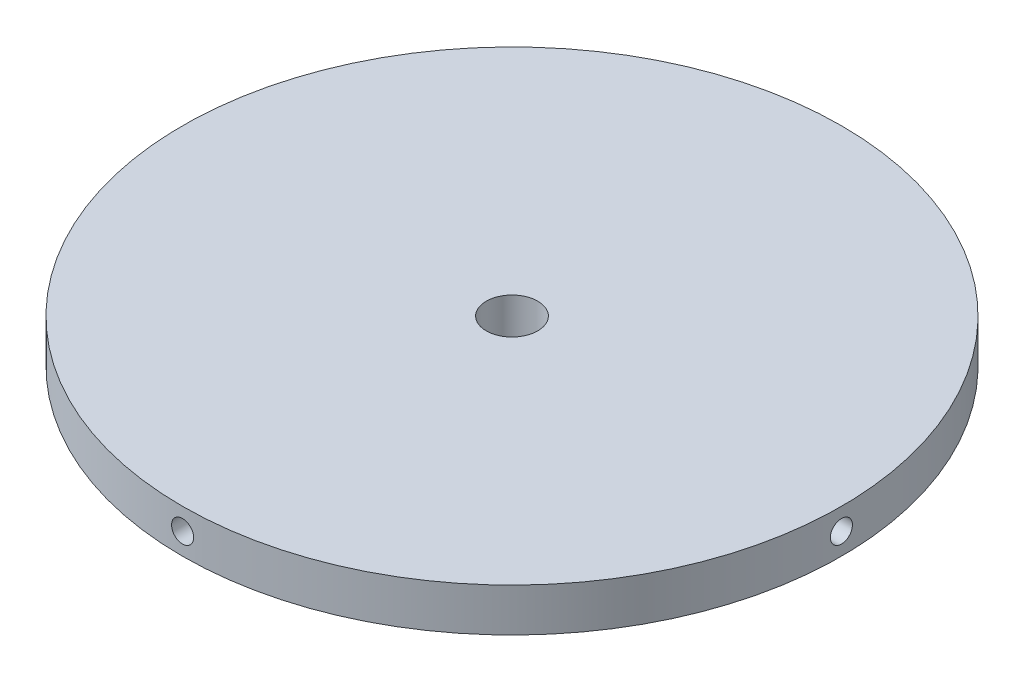
from build123d import *

# Parameters (mm, degrees)
SKETCH2_R               = 76.1746
BOSS_EXTRUDE1_DEPTH     = 10
CUT_EXTRUDE1_DEPTH      = 109.190292403
CUT_EXTRUDE1_DEPTH_BACK = 109.190292403
SKETCH3_R               = 5.953125
CIRPATTERN2_COUNT       = 4
CIRPATTERN2_ANGLE       = 270


with BuildPart() as part:
    # Sketch2 → Boss-Extrude1 (new body)
    with BuildSketch(Plane(origin=(0, 0, 0), x_dir=(1, 0, 0), z_dir=(0, 1, 0))):
        Circle(SKETCH2_R)
    extrude(amount=BOSS_EXTRUDE1_DEPTH)

    # Sketch3 → Cut-Extrude1 (cut, two sides: drawn at the far end of the back side and taken through both)
    with BuildSketch(Plane(origin=(0, 10, 0), x_dir=(1, 0, 0), z_dir=(0, 1, 0)).offset(-CUT_EXTRUDE1_DEPTH_BACK)):
        Circle(SKETCH3_R)
    extrude(amount=CUT_EXTRUDE1_DEPTH + CUT_EXTRUDE1_DEPTH_BACK, mode=Mode.SUBTRACT)

    # Sketch10 → 1/4-20 Tapped Hole1 (revolve, cut)
    with BuildSketch(Plane(origin=(-76.1746, 5, 0), x_dir=(0, 0, 1), z_dir=(0, 1, 0))):
        Polygon((0, 0), (0, 26.933816902), (2.5527, 25.4), (2.5527, 0), align=None)
    f_1_4_20_tapped_hole1 = revolve(axis=Axis((-82.5246, 5, 0), (1, 0, 0)), mode=Mode.SUBTRACT)

    # CirPattern2: 1/4-20 Tapped Hole1 ×4 about axis
    cirpattern2_axis = Axis((0, 10, 0), (0, -1, 0))
    for i in range(1, CIRPATTERN2_COUNT):
        add(f_1_4_20_tapped_hole1.rotate(cirpattern2_axis, i * CIRPATTERN2_ANGLE / (CIRPATTERN2_COUNT - 1)), mode=Mode.SUBTRACT)


solid = part.part
